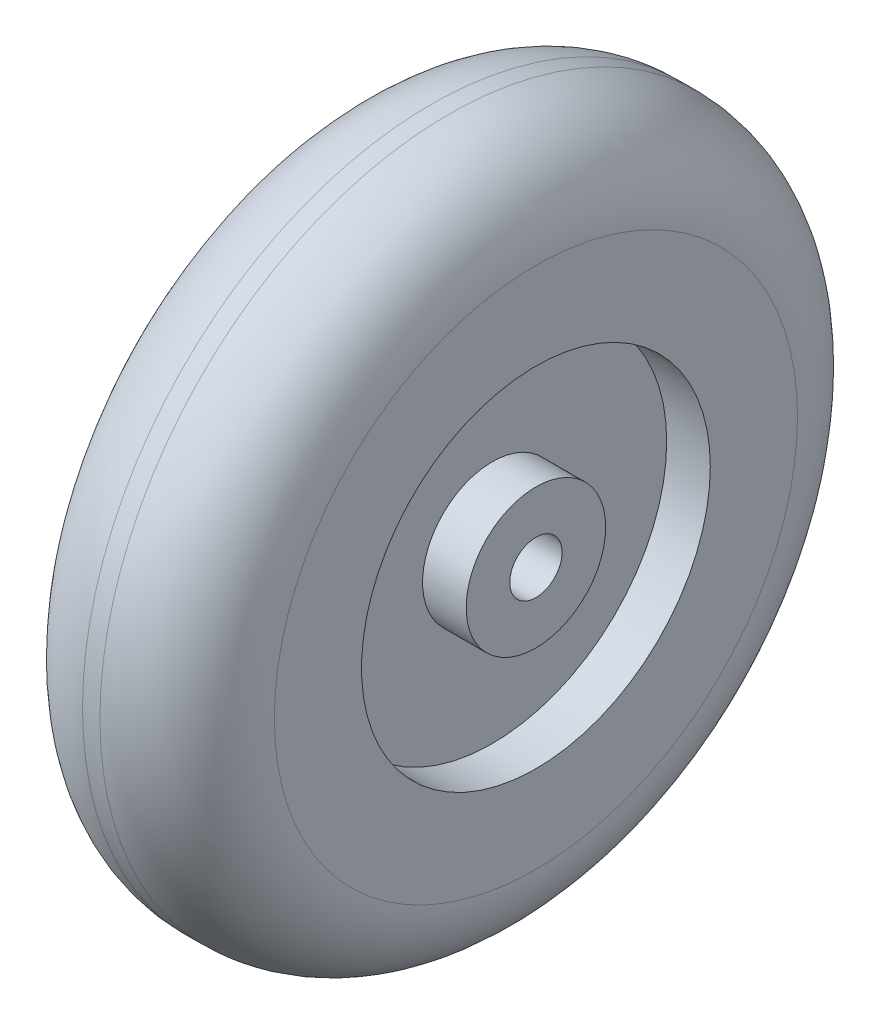
from build123d import *

# Parameters (mm, degrees)
SKETCH2_R           = 20
SKETCH2_R_2         = 1.5
BOSS_EXTRUDE1_DEPTH = 5.5
FILLET1_R           = 5
SKETCH3_R           = 10
SKETCH3_R_2         = 4
CUT_EXTRUDE1_DEPTH  = 2.5
CUT_EXTRUDE2_START  = -2.5
SKETCH4_R           = 10
SKETCH4_R_2         = 4
CUT_EXTRUDE2_DEPTH  = 2.5


with BuildPart() as part:
    # Sketch2 → Boss-Extrude1 (new, symmetric)
    with BuildSketch(Plane(origin=(0, 0, 0), x_dir=(0, 0, -1), z_dir=(1, 0, 0))):
        Circle(SKETCH2_R)
        Circle(SKETCH2_R_2, mode=Mode.SUBTRACT)
    extrude(amount=BOSS_EXTRUDE1_DEPTH, both=True)

    # Fillet1
    fillet1_edges = [part.edges().sort_by_distance(p)[0] for p in [
        (-5.5, 0, 20),
        (5.5, 0, 20),
    ]]
    fillet(fillet1_edges, radius=FILLET1_R)

    # Sketch3 → Cut-Extrude1 (cut)
    with BuildSketch(Plane(origin=(5.5, 0, 0), x_dir=(0, 0, -1), z_dir=(1, 0, 0))):
        Circle(SKETCH3_R)
        Circle(SKETCH3_R_2, mode=Mode.SUBTRACT)
    extrude(amount=-CUT_EXTRUDE1_DEPTH, mode=Mode.SUBTRACT)

    # Sketch4 → Cut-Extrude2 (cut)
    with BuildSketch(Plane.ZY.offset(5.5).offset(CUT_EXTRUDE2_START)):
        Circle(SKETCH4_R)
        Circle(SKETCH4_R_2, mode=Mode.SUBTRACT)
    extrude(amount=CUT_EXTRUDE2_DEPTH, mode=Mode.SUBTRACT)


solid = part.part
